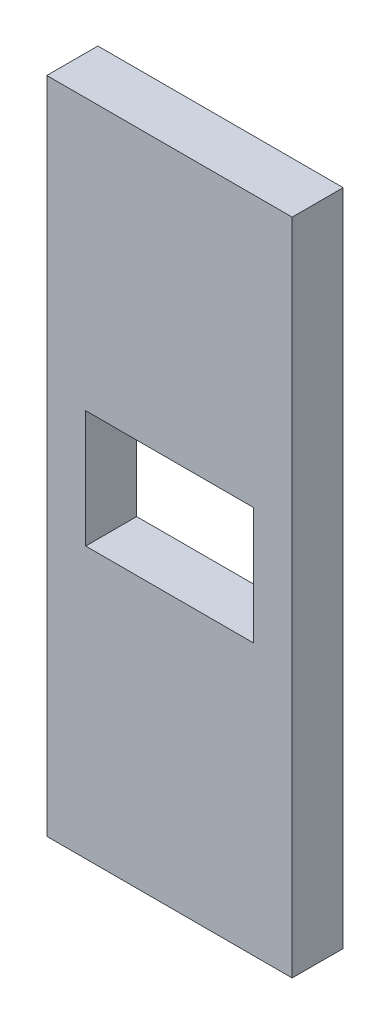
from build123d import *

# Parameters (mm, degrees)
SKETCH1_W           = 17.08
SKETCH1_H           = 11.95
BOSS_EXTRUDE1_DEPTH = 5.2


with BuildPart() as part:
    # Sketch1 → Boss-Extrude1 (new body)
    with BuildSketch(Plane.XY):
        Polygon((0, 67.15), (0, 44.75), (0, 39.55), (0, 27.6), (0, 22.4), (0, 0), (25, 0), (25, 22.4), (25, 27.6), (25, 39.55), (25, 44.75), (25, 67.15), align=None)
        with Locations((12.5, 33.575)):
            Rectangle(SKETCH1_W, SKETCH1_H, mode=Mode.SUBTRACT)
    extrude(amount=BOSS_EXTRUDE1_DEPTH)


solid = part.part
